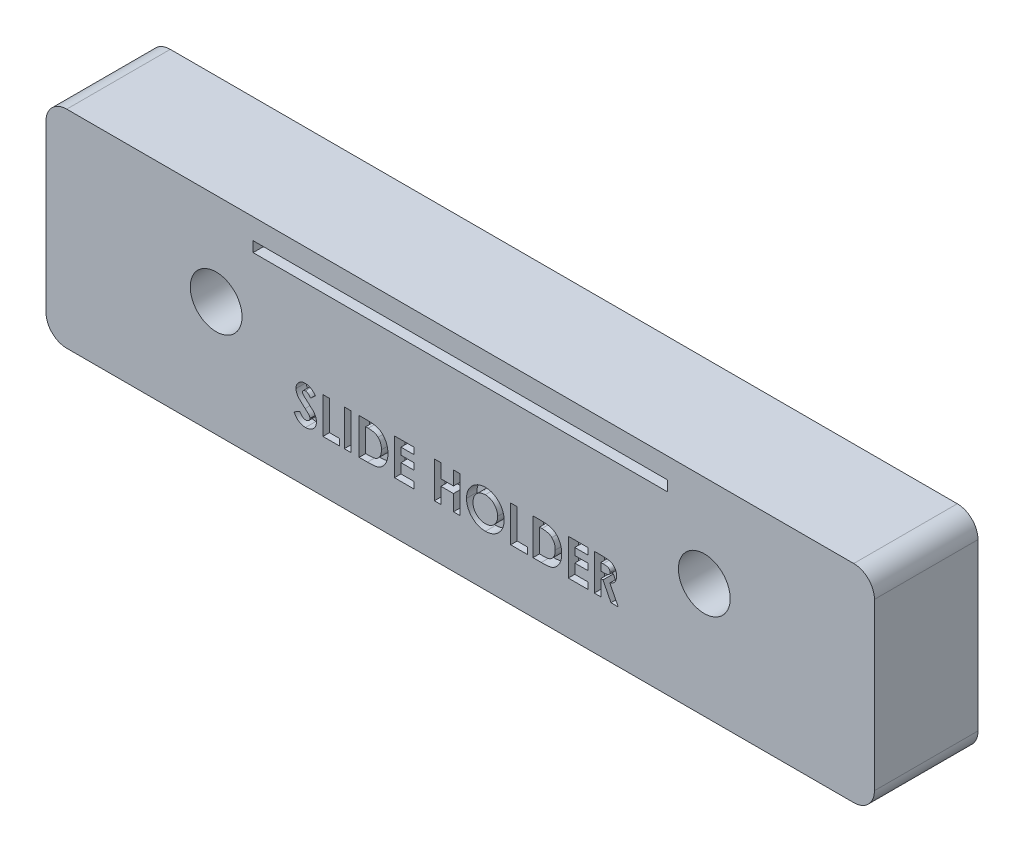
from build123d import *

# Parameters (mm, degrees)
SKETCH1_W           = 80
SKETCH1_H           = 20
BOSS_EXTRUDE1_DEPTH = 10
SKETCH2_R           = 2.5
CUT_EXTRUDE1_DEPTH  = 10
SKETCH3_W           = 40
SKETCH3_H           = 1
CUT_EXTRUDE2_DEPTH  = 47.813641243
SKETCH4_W           = 0.628205128
SKETCH4_H           = 3.5
CUT_EXTRUDE3_DEPTH  = 1
FILLET1_R           = 2


with BuildPart() as part:
    # Sketch1 → Boss-Extrude1 (new body)
    with BuildSketch(Plane.XY):
        with Locations((-0.372188153, 11.484958231)):
            Rectangle(SKETCH1_W, SKETCH1_H)
    extrude(amount=BOSS_EXTRUDE1_DEPTH)

    # Sketch2 → Cut-Extrude1 (cut)
    with BuildSketch(Plane.XY.offset(10)):
        with Locations((-23.942188153, 12.584958231)):
            Circle(SKETCH2_R)
        with Locations((23.197811847, 12.584958231)):
            Circle(SKETCH2_R)
    extrude(amount=-CUT_EXTRUDE1_DEPTH, mode=Mode.SUBTRACT)

    # Sketch3 → Cut-Extrude2 (cut, through all)
    with BuildSketch(Plane.XY.offset(10)):
        with Locations((-0.372188153, 18.984958231)):
            Rectangle(SKETCH3_W, SKETCH3_H)
    extrude(amount=-CUT_EXTRUDE2_DEPTH, mode=Mode.SUBTRACT)

    # Sketch4 → Cut-Extrude3 (cut)
    # profile 1 of 11: a face of its own
    with BuildSketch(Plane.XY.offset(10)):
        with BuildLine():
            Line((-14.349752255, 9.517309993), (-14.819503858, 9.087522333))
            add(Edge.make_bspline(
                [(-14.819503858, 9.087522333), (-14.839626002, 9.11590671), (-14.878257713, 9.170400754), (-14.940875688, 9.243369565), (-15.00321091, 9.30561739), (-15.065840877, 9.356884188), (-15.129320719, 9.396858475), (-15.193540243, 9.425160711), (-15.25813537, 9.443152712), (-15.301533325, 9.445393148), (-15.322909306, 9.446496692)],
                knots=[0, 0, 0, 0, 1.299362458, 2.494594718, 3.587462134, 4.587049575, 5.512617175, 6.380583204, 7.202344345, 8, 8, 8, 8], degree=3))
            add(Edge.make_bspline(
                [(-15.322909306, 9.446496692), (-15.342848209, 9.445797436), (-15.381344991, 9.444447357), (-15.43622501, 9.431027668), (-15.484948273, 9.407867256), (-15.527467227, 9.377583068), (-15.561148512, 9.341097643), (-15.588040406, 9.302833813), (-15.603182803, 9.260599199), (-15.60517584, 9.231590762), (-15.606162511, 9.217229865)],
                knots=[0, 0, 0, 0, 1.185010067, 2.2879431, 3.333075148, 4.379039566, 5.372662701, 6.27520591, 7.14612461, 8, 8, 8, 8], degree=3))
            add(Edge.make_bspline(
                [(-15.606162511, 9.217229865), (-15.605544214, 9.202661878), (-15.60429905, 9.173323975), (-15.592272456, 9.130325625), (-15.574144945, 9.088311232), (-15.556823368, 9.062735072), (-15.547969403, 9.049661756)],
                knots=[0, 0, 0, 0, 0.967525499, 1.948461899, 2.951351359, 4, 4, 4, 4], degree=3))
            add(Edge.make_bspline(
                [(-15.547969403, 9.049661756), (-15.53992019, 9.039500005), (-15.521391965, 9.016108994), (-15.486062436, 8.97906128), (-15.441695968, 8.933674587), (-15.386585244, 8.881509632), (-15.323018063, 8.820690357), (-15.248048005, 8.753607592), (-15.163833033, 8.678183861), (-15.103974983, 8.625661507), (-15.072608826, 8.59813932)],
                knots=[0, 0, 0, 0, 0.473873513, 1.090794244, 1.870441696, 2.795289791, 3.865433203, 5.087734844, 6.473946851, 8, 8, 8, 8], degree=3))
            add(Edge.make_bspline(
                [(-15.072608826, 8.59813932), (-15.043167175, 8.572659057), (-14.987293039, 8.524302811), (-14.907795239, 8.455668883), (-14.837929914, 8.393920612), (-14.776679284, 8.339984707), (-14.724971849, 8.293295256), (-14.682590231, 8.253629086), (-14.649016812, 8.221758422), (-14.629932288, 8.202508522), (-14.621787511, 8.194293166)],
                knots=[0, 0, 0, 0, 1.543621617, 2.929473131, 4.163658386, 5.240097082, 6.164993805, 6.925417477, 7.541396219, 8, 8, 8, 8], degree=3))
            add(Edge.make_bspline(
                [(-14.621787511, 8.194293166), (-14.590887927, 8.160853198), (-14.531488074, 8.096569836), (-14.454289205, 7.996950841), (-14.390752039, 7.899702389), (-14.341598483, 7.802994593), (-14.30447574, 7.705432152), (-14.278303714, 7.604622352), (-14.262629114, 7.499511794), (-14.260888867, 7.42778667), (-14.260008665, 7.391508711)],
                knots=[0, 0, 0, 0, 1.206664779, 2.319633467, 3.337109185, 4.282041471, 5.190008762, 6.099243693, 7.03861361, 8, 8, 8, 8], degree=3))
            add(Edge.make_bspline(
                [(-14.260008665, 7.391508711), (-14.260635171, 7.35616029), (-14.261864397, 7.286805371), (-14.276920065, 7.185314779), (-14.298388563, 7.088183877), (-14.331582628, 6.996469588), (-14.372039357, 6.908666449), (-14.422757711, 6.826142153), (-14.482319463, 6.748061522), (-14.550586376, 6.675820342), (-14.626097688, 6.610266479), (-14.707090746, 6.551908881), (-14.794357542, 6.50372725), (-14.887152482, 6.464053114), (-14.985425894, 6.433495565), (-15.089060706, 6.410910687), (-15.198215434, 6.3973556), (-15.27285701, 6.395938576), (-15.310990236, 6.395214641)],
                knots=[0, 0, 0, 0, 1.043214005, 2.046824704, 3.02475056, 3.976699089, 4.921714032, 5.875962561, 6.831408892, 7.817874052, 8.806269674, 9.781291748, 10.760897367, 11.74438705, 12.757449933, 13.795994037, 14.874007457, 16, 16, 16, 16], degree=3))
            add(Edge.make_bspline(
                [(-15.310990236, 6.395214641), (-15.340924494, 6.395745695), (-15.400211491, 6.396797485), (-15.487591563, 6.405384482), (-15.5719669, 6.419242981), (-15.65324246, 6.43910635), (-15.731784406, 6.464275933), (-15.807595962, 6.495019614), (-15.880153776, 6.531813909), (-15.950006855, 6.57390218), (-16.016815626, 6.622772208), (-16.081424861, 6.677424859), (-16.143192799, 6.738700717), (-16.202416099, 6.806454866), (-16.258715834, 6.88087917), (-16.313934896, 6.960937133), (-16.365619184, 7.048114521), (-16.397546867, 7.109270164), (-16.413854819, 7.140507109)],
                knots=[0, 0, 0, 0, 1.016823716, 2.013894106, 2.979844003, 3.91962641, 4.853723003, 5.779685073, 6.695824784, 7.614987388, 8.547259901, 9.504950863, 10.487499108, 11.500346958, 12.559593716, 13.656357062, 14.802919212, 16, 16, 16, 16], degree=3))
            Line((-16.413854819, 7.140507109), (-15.861370845, 7.472137718))
            add(Edge.make_bspline(
                [(-15.861370845, 7.472137718), (-15.840972034, 7.436679704), (-15.801865771, 7.368703661), (-15.735596552, 7.277369232), (-15.66770712, 7.199156412), (-15.596627932, 7.135447618), (-15.523223285, 7.085390981), (-15.447138618, 7.049617036), (-15.368320474, 7.027473004), (-15.314633135, 7.024768707), (-15.287853217, 7.023419769)],
                knots=[0, 0, 0, 0, 1.283663364, 2.460892379, 3.537111102, 4.529833553, 5.449777664, 6.316464042, 7.160231139, 8, 8, 8, 8], degree=3))
            add(Edge.make_bspline(
                [(-15.287853217, 7.023419769), (-15.260614206, 7.024521385), (-15.207766557, 7.026658679), (-15.132333302, 7.046400227), (-15.063173237, 7.077395904), (-15.003391788, 7.121622461), (-14.952772626, 7.17266663), (-14.915412779, 7.229455602), (-14.891943071, 7.290899899), (-14.889461754, 7.333583149), (-14.888213794, 7.355050378)],
                knots=[0, 0, 0, 0, 1.13588714, 2.203786484, 3.234766741, 4.283437687, 5.291419208, 6.222934724, 7.106237994, 8, 8, 8, 8], degree=3))
            add(Edge.make_bspline(
                [(-14.888213794, 7.355050378), (-14.889366234, 7.375022141), (-14.891707306, 7.415592866), (-14.908950922, 7.475915011), (-14.935907953, 7.536209722), (-14.967800022, 7.585665076), (-15.000254195, 7.627072702), (-15.031287705, 7.662950538), (-15.06907831, 7.702589265), (-15.113530191, 7.746038746), (-15.164056023, 7.793681479), (-15.220698365, 7.845512797), (-15.284105834, 7.901076128), (-15.328922359, 7.938925321), (-15.352356422, 7.958716243)],
                knots=[0, 0, 0, 0, 0.916159276, 1.861089862, 2.860218735, 3.940849679, 4.552606315, 5.27541173, 6.11797699, 7.06649574, 8.129236253, 9.306560635, 10.591630461, 12, 12, 12, 12], degree=3))
            add(Edge.make_bspline(
                [(-15.352356422, 7.958716243), (-15.396905508, 7.996409042), (-15.482408689, 8.068752932), (-15.603235531, 8.175602581), (-15.712111335, 8.275463367), (-15.808095732, 8.36956979), (-15.892411711, 8.456183922), (-15.964488248, 8.536009275), (-16.023533551, 8.609661594), (-16.085665999, 8.696897837), (-16.144704248, 8.803201193), (-16.195730049, 8.931096453), (-16.228833434, 9.058975486), (-16.232542208, 9.144826424), (-16.23436764, 9.187081628)],
                knots=[0, 0, 0, 0, 1.345494975, 2.582412109, 3.71882943, 4.751509156, 5.681369928, 6.505683931, 7.230279997, 7.856715994, 8.973648664, 10.023341002, 11.027102913, 12, 12, 12, 12], degree=3))
            add(Edge.make_bspline(
                [(-16.23436764, 9.187081628), (-16.233608445, 9.21704675), (-16.232112751, 9.27608126), (-16.218770923, 9.362882906), (-16.198831054, 9.4466392), (-16.169872639, 9.527044562), (-16.132288114, 9.603998281), (-16.086643167, 9.677877078), (-16.03222902, 9.748000989), (-15.97090795, 9.814323527), (-15.903347831, 9.87493478), (-15.831151258, 9.928430283), (-15.75472687, 9.973613363), (-15.674542192, 10.011096009), (-15.590100355, 10.039786593), (-15.502023437, 10.060123909), (-15.410185107, 10.072219896), (-15.347718657, 10.073864205), (-15.315898088, 10.07470182)],
                knots=[0, 0, 0, 0, 1.010766082, 1.991317756, 2.957454644, 3.913069143, 4.869106762, 5.843196583, 6.838735724, 7.860187025, 8.887984031, 9.89767229, 10.887916223, 11.879572884, 12.879850636, 13.892031539, 14.926195476, 16, 16, 16, 16], degree=3))
            add(Edge.make_bspline(
                [(-15.315898088, 10.07470182), (-15.274660206, 10.073193251), (-15.192509958, 10.07018802), (-15.071048447, 10.046688095), (-14.952409922, 10.009731987), (-14.856808774, 9.965148509), (-14.780740726, 9.921960473), (-14.722441673, 9.882198369), (-14.663119248, 9.836648743), (-14.602295053, 9.785168054), (-14.541099296, 9.72678634), (-14.477791889, 9.662893423), (-14.413235472, 9.592937118), (-14.371284036, 9.542960658), (-14.349752255, 9.517309993)],
                knots=[0, 0, 0, 0, 1.282922637, 2.555718331, 3.837320111, 5.142675274, 5.830281639, 6.55870424, 7.337177975, 8.157850921, 9.037902056, 9.96903443, 10.957596896, 12, 12, 12, 12], degree=3))
        make_face()
    # profile 2 of 11: a face of its own
    with BuildSketch(Plane.XY.offset(10)):
        Polygon((-13.631803537, 9.984958231), (-13.003598409, 9.984958231), (-13.003598409, 7.113163359), (-12.016418922, 7.113163359), (-12.016418922, 6.484958231), (-13.631803537, 6.484958231), align=None)
    # profile 3 of 11: a face of its own
    with BuildSketch(Plane.XY.offset(10)):
        with Locations((-11.253598409, 8.234958231)):
            Rectangle(SKETCH4_W, SKETCH4_H)
    # profile 4 of 11: a face of its own
    with BuildSketch(Plane.XY.offset(10)):
        with BuildLine():
            Line((-10.131803537, 9.984958231), (-9.340237031, 9.984958231))
            add(Edge.make_bspline(
                [(-9.340237031, 9.984958231), (-9.278525317, 9.984526845), (-9.159235876, 9.983692971), (-8.986409077, 9.974297216), (-8.825702145, 9.959847212), (-8.677011488, 9.939968613), (-8.540641944, 9.913663783), (-8.41676936, 9.880669529), (-8.304977988, 9.842583152), (-8.204042061, 9.797766801), (-8.111897268, 9.745515387), (-8.024402846, 9.687311506), (-7.941730589, 9.621022981), (-7.862720321, 9.547928649), (-7.788391688, 9.466691271), (-7.717506852, 9.378656434), (-7.651801394, 9.282547511), (-7.589289181, 9.18066889), (-7.532755202, 9.07258882), (-7.483444154, 8.959227255), (-7.44213599, 8.841313719), (-7.408570967, 8.718722549), (-7.38181577, 8.591860707), (-7.363095698, 8.460472201), (-7.351522763, 8.324678672), (-7.350348786, 8.232644731), (-7.349752255, 8.185879705)],
                knots=[0, 0, 0, 0, 1.44355588, 2.790409838, 4.047694926, 5.217575253, 6.298404546, 7.294384826, 8.214239204, 9.058592145, 9.873746385, 10.689560431, 11.514393297, 12.350027578, 13.205127629, 14.088021785, 14.991911688, 15.926770944, 16.882954281, 17.842803888, 18.816321264, 19.80318086, 20.814351908, 21.847355356, 22.906180909, 24, 24, 24, 24], degree=3))
            add(Edge.make_bspline(
                [(-7.349752255, 8.185879705), (-7.351314295, 8.119891209), (-7.354389262, 7.989988993), (-7.380291065, 7.799358988), (-7.422183052, 7.616621114), (-7.48108699, 7.44320482), (-7.554112105, 7.280654401), (-7.641348783, 7.131836367), (-7.741517929, 6.997549498), (-7.853452569, 6.878462432), (-7.974650522, 6.776105485), (-8.100599634, 6.68844425), (-8.232526881, 6.619316051), (-8.348773223, 6.575478436), (-8.449573303, 6.548215232), (-8.538074683, 6.532102416), (-8.638603221, 6.517325992), (-8.752096258, 6.505907089), (-8.878055925, 6.495724234), (-9.016984298, 6.490191267), (-9.168431567, 6.485594192), (-9.273626014, 6.485175772), (-9.32831796, 6.484958231)],
                knots=[0, 0, 0, 0, 1.315458931, 2.589557908, 3.828601765, 5.048913369, 6.235739168, 7.376350998, 8.481830359, 9.569842114, 10.627874879, 11.640079404, 12.624025415, 13.590060155, 14.111227486, 14.704434459, 15.382649715, 16.137166398, 16.978595427, 17.902333227, 18.909396075, 20, 20, 20, 20], degree=3))
            Line((-9.32831796, 6.484958231), (-10.131803537, 6.484958231))
            Line((-10.131803537, 6.484958231), (-10.131803537, 9.984958231))
        make_face()
        with BuildLine():
            Line((-9.503598409, 9.356753102), (-9.503598409, 7.113163359))
            Line((-9.503598409, 7.113163359), (-9.175473409, 7.113163359))
            add(Edge.make_bspline(
                [(-9.175473409, 7.113163359), (-9.136431573, 7.1132349), (-9.061341126, 7.113372496), (-8.952927517, 7.11992635), (-8.852672419, 7.126504612), (-8.760851809, 7.138990373), (-8.676797445, 7.152898632), (-8.601664016, 7.172253879), (-8.533902693, 7.192584927), (-8.474341169, 7.21846887), (-8.419787665, 7.247602971), (-8.369277353, 7.281736947), (-8.320520759, 7.319641441), (-8.274429429, 7.362431277), (-8.230828917, 7.409539837), (-8.189977191, 7.461209851), (-8.15132899, 7.517283672), (-8.115876339, 7.578057777), (-8.083479517, 7.642890377), (-8.054739905, 7.711153473), (-8.030910527, 7.783415551), (-8.011105006, 7.85900015), (-7.996951715, 7.93856532), (-7.985242567, 8.021521734), (-7.97920616, 8.108198056), (-7.978377701, 8.167175523), (-7.977957383, 8.197097654)],
                knots=[0, 0, 0, 0, 1.50275155, 2.890291501, 4.180787663, 5.369391935, 6.45668281, 7.458360028, 8.354766181, 9.177074746, 9.954075863, 10.732690366, 11.5210699, 12.329727389, 13.151100085, 13.990027547, 14.863562427, 15.770965086, 16.696477834, 17.652329173, 18.619756807, 19.62365428, 20.657822005, 21.729286259, 22.847956731, 24, 24, 24, 24], degree=3))
            add(Edge.make_bspline(
                [(-7.977957383, 8.197097654), (-7.978794513, 8.24295049), (-7.980426852, 8.332359969), (-7.996168771, 8.462586827), (-8.021793612, 8.585214922), (-8.058357792, 8.699789149), (-8.104448074, 8.806631522), (-8.162140805, 8.90483686), (-8.228953114, 8.996054876), (-8.281786464, 9.049566291), (-8.308185749, 9.076304384)],
                knots=[0, 0, 0, 0, 1.13821349, 2.219428113, 3.251817212, 4.244760574, 5.201143372, 6.134805572, 7.068016741, 8, 8, 8, 8], degree=3))
            add(Edge.make_bspline(
                [(-8.308185749, 9.076304384), (-8.334217943, 9.099088855), (-8.387385752, 9.145623556), (-8.480730952, 9.201384028), (-8.583592529, 9.250375068), (-8.698323646, 9.289219499), (-8.823815478, 9.319939331), (-8.960815458, 9.341126048), (-9.10858992, 9.354740408), (-9.210964624, 9.356067831), (-9.263814755, 9.356753102)],
                knots=[0, 0, 0, 0, 0.813307809, 1.661089106, 2.549956539, 3.493439533, 4.508053171, 5.589449661, 6.755572447, 8, 8, 8, 8], degree=3))
            Line((-9.263814755, 9.356753102), (-9.503598409, 9.356753102))
        make_face(mode=Mode.SUBTRACT)
    # profile 5 of 11: a face of its own
    with BuildSketch(Plane.XY.offset(10)):
        Polygon((-6.721547127, 9.984958231), (-4.836931742, 9.984958231), (-4.836931742, 9.356753102), (-6.093341999, 9.356753102), (-6.093341999, 8.683676179), (-4.836931742, 8.683676179), (-4.836931742, 8.055471051), (-6.093341999, 8.055471051), (-6.093341999, 7.113163359), (-4.836931742, 7.113163359), (-4.836931742, 6.484958231), (-6.721547127, 6.484958231), align=None)
    # profile 6 of 11: a face of its own
    with BuildSketch(Plane.XY.offset(10)):
        Polygon((-2.862572768, 9.984958231), (-2.23436764, 9.984958231), (-2.23436764, 8.638804384), (-1.022829178, 8.638804384), (-1.022829178, 9.984958231), (-0.39462405, 9.984958231), (-0.39462405, 6.484958231), (-1.022829178, 6.484958231), (-1.022829178, 8.010599256), (-2.23436764, 8.010599256), (-2.23436764, 6.484958231), (-2.862572768, 6.484958231), align=None)
    # profile 7 of 11: a face of its own
    with BuildSketch(Plane.XY.offset(10)):
        with BuildLine():
            add(Edge.make_bspline(
                [(2.057899989, 10.07470182), (2.118751778, 10.073126259), (2.238886993, 10.070015743), (2.415562542, 10.044087165), (2.585822101, 10.001840266), (2.749588678, 9.94311402), (2.906452222, 9.866317822), (3.056966042, 9.773628896), (3.200591005, 9.663297792), (3.335855357, 9.537898354), (3.460864014, 9.40153194), (3.569184088, 9.254709252), (3.661555474, 9.101234612), (3.738113125, 8.940696782), (3.796426027, 8.771983959), (3.837346602, 8.595956357), (3.863636044, 8.412664053), (3.866659734, 8.287866977), (3.868196463, 8.224441404)],
                knots=[0, 0, 0, 0, 1.014329547, 2.002516266, 2.970391464, 3.935626869, 4.897733899, 5.877609409, 6.878433252, 7.912639331, 8.949961323, 9.958554974, 10.949718813, 11.932905612, 12.9188844, 13.919928257, 14.942845884, 16, 16, 16, 16], degree=3))
            add(Edge.make_bspline(
                [(3.868196463, 8.224441404), (3.866559913, 8.16173049), (3.863335039, 8.038156623), (3.838419852, 7.85655343), (3.796810169, 7.68241145), (3.7394863, 7.515336509), (3.664317115, 7.35613786), (3.573747072, 7.203799042), (3.4653862, 7.059733797), (3.343186846, 6.924019434), (3.208655961, 6.800829529), (3.066166398, 6.692268638), (2.916376085, 6.600278235), (2.759504267, 6.524900457), (2.595214541, 6.46640254), (2.423912721, 6.425128009), (2.245609409, 6.400044643), (2.124354509, 6.396840833), (2.062807841, 6.395214641)],
                knots=[0, 0, 0, 0, 1.051557043, 2.072126891, 3.067553643, 4.050577992, 5.02905126, 6.015227836, 7.017913613, 8.04756643, 9.074058332, 10.072836633, 11.047628519, 12.017157415, 12.98668631, 13.966869689, 14.968021931, 16, 16, 16, 16], degree=3))
            add(Edge.make_bspline(
                [(2.062807841, 6.395214641), (1.998437406, 6.396673416), (1.871958299, 6.399539709), (1.68685556, 6.426796848), (1.509511142, 6.467855622), (1.34141484, 6.529133638), (1.180854737, 6.605736312), (1.029010515, 6.700077097), (0.885933204, 6.812000088), (0.752443519, 6.938638896), (0.63150154, 7.077209529), (0.524746521, 7.223597113), (0.434696295, 7.376683378), (0.361347566, 7.53653997), (0.303522374, 7.70217342), (0.262733272, 7.874592483), (0.238638176, 8.053383636), (0.235281869, 8.174822161), (0.233581078, 8.236360474)],
                knots=[0, 0, 0, 0, 1.067978421, 2.098431617, 3.099715153, 4.085208694, 5.062210972, 6.048429807, 7.046490867, 8.072918869, 9.098532598, 10.095778865, 11.076610158, 12.041847152, 13.011192615, 13.984257998, 14.978533688, 16, 16, 16, 16], degree=3))
            add(Edge.make_bspline(
                [(0.233581078, 8.236360474), (0.234114884, 8.27776023), (0.235175737, 8.360035525), (0.247954826, 8.481963312), (0.26635304, 8.601511233), (0.293563126, 8.718202648), (0.326616426, 8.832860761), (0.369441644, 8.944418305), (0.418188333, 9.054067022), (0.475144249, 9.160511823), (0.53847372, 9.262773328), (0.607571811, 9.36036915), (0.682612269, 9.452119214), (0.763353364, 9.538626463), (0.850073339, 9.619322279), (0.941631484, 9.695349023), (1.039803493, 9.764687155), (1.142440689, 9.829030051), (1.248964427, 9.887214215), (1.358941058, 9.936738836), (1.470104848, 9.979987843), (1.583940794, 10.014121873), (1.699228942, 10.041923682), (1.817200912, 10.060309496), (1.936790894, 10.073088231), (2.017434485, 10.074162681), (2.057899989, 10.07470182)],
                knots=[0, 0, 0, 0, 1.034744296, 2.056386356, 3.06226378, 4.057406941, 5.050368692, 6.043467995, 7.042652155, 8.049140477, 9.059438543, 10.048523776, 11.036952808, 12.020949711, 13.004946614, 13.997082645, 14.994316842, 16.007702937, 17.024872941, 18.026463647, 19.021641123, 20.005082605, 20.995858141, 21.984425357, 22.988620895, 24, 24, 24, 24], degree=3))
        make_face()
        with BuildLine():
            add(Edge.make_bspline(
                [(2.048084283, 9.446496692), (2.007131037, 9.445397825), (1.926305717, 9.4432291), (1.807749692, 9.42670635), (1.693931721, 9.40031764), (1.585482743, 9.362093917), (1.481932729, 9.313444819), (1.383098118, 9.254540331), (1.290347565, 9.183355678), (1.20244433, 9.103712446), (1.123038223, 9.014971583), (1.052880422, 8.919870656), (0.994169643, 8.818568482), (0.944998997, 8.712006135), (0.907984399, 8.598985349), (0.881620011, 8.480391428), (0.864958701, 8.356020029), (0.862858522, 8.271236208), (0.861786206, 8.227947013)],
                knots=[0, 0, 0, 0, 1.033739768, 2.040188636, 3.016340934, 3.979330865, 4.937572243, 5.900995986, 6.878200029, 7.884839167, 8.891893314, 9.879764717, 10.863503415, 11.843163062, 12.837761627, 13.859916423, 14.907309254, 16, 16, 16, 16], degree=3))
            add(Edge.make_bspline(
                [(0.861786206, 8.227947013), (0.863207934, 8.179972846), (0.865994284, 8.085951429), (0.885599381, 7.948795519), (0.919141751, 7.819265375), (0.967576281, 7.697994508), (1.027647806, 7.583636298), (1.102247105, 7.477592367), (1.190166024, 7.379227773), (1.257898046, 7.321798425), (1.292274989, 7.292650538)],
                knots=[0, 0, 0, 0, 1.078454662, 2.113592447, 3.107694534, 4.079536787, 5.043276885, 6.005368276, 6.987637804, 8, 8, 8, 8], degree=3))
            add(Edge.make_bspline(
                [(1.292274989, 7.292650538), (1.320436267, 7.271117199), (1.376124346, 7.22853567), (1.465014644, 7.173958705), (1.556554147, 7.127180801), (1.651433636, 7.089384809), (1.749452731, 7.059655117), (1.85059799, 7.038835902), (1.954726098, 7.025770044), (2.025142405, 7.024208427), (2.060704476, 7.023419769)],
                knots=[0, 0, 0, 0, 1.023928204, 2.024787132, 3.009472467, 3.9914905, 4.972207045, 5.96565515, 6.972602802, 8, 8, 8, 8], degree=3))
            add(Edge.make_bspline(
                [(2.060704476, 7.023419769), (2.10095353, 7.024527954), (2.18014481, 7.026708342), (2.29649385, 7.043027688), (2.407959765, 7.070645913), (2.515234544, 7.108534324), (2.618008854, 7.157794254), (2.715780409, 7.218525774), (2.80872063, 7.28998318), (2.896511877, 7.370672302), (2.976757226, 7.459762743), (3.046768622, 7.555370928), (3.107346111, 7.655390324), (3.155494252, 7.761236552), (3.193971213, 7.871910475), (3.220018293, 7.987902243), (3.236820353, 8.108733694), (3.238921123, 8.190963766), (3.239991335, 8.232854865)],
                knots=[0, 0, 0, 0, 1.026359118, 2.019393844, 2.989460624, 3.950973911, 4.916101784, 5.890408035, 6.881132271, 7.902007068, 8.92769091, 9.933912415, 10.920395702, 11.90457117, 12.894218921, 13.903490204, 14.931958862, 16, 16, 16, 16], degree=3))
            add(Edge.make_bspline(
                [(3.239991335, 8.232854865), (3.238884094, 8.274505079), (3.236704658, 8.356487173), (3.220356589, 8.477007967), (3.192913512, 8.592487665), (3.154911326, 8.703114858), (3.106384547, 8.808998001), (3.046376261, 8.909764747), (2.975097031, 9.005317679), (2.894187343, 9.095005641), (2.806122121, 9.177423132), (2.711575305, 9.248946533), (2.613192423, 9.311098094), (2.50871609, 9.359785117), (2.400283804, 9.398573965), (2.287233907, 9.427138629), (2.169138215, 9.443113027), (2.088795273, 9.44535875), (2.048084283, 9.446496692)],
                knots=[0, 0, 0, 0, 1.055025985, 2.07665775, 3.074803781, 4.057872707, 5.035505728, 6.020516407, 7.023567878, 8.050795229, 9.077271434, 10.074415901, 11.050397877, 12.019801805, 12.988065821, 13.964604439, 14.968634123, 16, 16, 16, 16], degree=3))
        make_face(mode=Mode.SUBTRACT)
    # profile 8 of 11: a face of its own
    with BuildSketch(Plane.XY.offset(10)):
        Polygon((4.496401591, 9.984958231), (5.124606719, 9.984958231), (5.124606719, 7.113163359), (6.111786206, 7.113163359), (6.111786206, 6.484958231), (4.496401591, 6.484958231), align=None)
    # profile 9 of 11: a face of its own
    with BuildSketch(Plane.XY.offset(10)):
        with BuildLine():
            Line((6.650247745, 9.984958231), (7.441814251, 9.984958231))
            add(Edge.make_bspline(
                [(7.441814251, 9.984958231), (7.503525965, 9.984526845), (7.622815406, 9.983692971), (7.795642205, 9.974297216), (7.956349137, 9.959847212), (8.105039794, 9.939968613), (8.241409338, 9.913663783), (8.365281923, 9.880669529), (8.477073294, 9.842583152), (8.578009221, 9.797766801), (8.670154014, 9.745515387), (8.757648436, 9.687311506), (8.840320693, 9.621022981), (8.919330961, 9.547928649), (8.993659594, 9.466691271), (9.06454443, 9.378656434), (9.130249888, 9.282547511), (9.192762101, 9.18066889), (9.24929608, 9.07258882), (9.298607128, 8.959227255), (9.339915292, 8.841313719), (9.373480315, 8.718722549), (9.400235512, 8.591860707), (9.418955584, 8.460472201), (9.430528519, 8.324678672), (9.431702496, 8.232644731), (9.432299027, 8.185879705)],
                knots=[0, 0, 0, 0, 1.44355588, 2.790409838, 4.047694926, 5.217575253, 6.298404546, 7.294384826, 8.214239204, 9.058592145, 9.873746385, 10.689560431, 11.514393297, 12.350027578, 13.205127629, 14.088021785, 14.991911688, 15.926770944, 16.882954281, 17.842803888, 18.816321264, 19.80318086, 20.814351908, 21.847355356, 22.906180909, 24, 24, 24, 24], degree=3))
            add(Edge.make_bspline(
                [(9.432299027, 8.185879705), (9.430736987, 8.119891209), (9.42766202, 7.989988993), (9.401760217, 7.799358988), (9.35986823, 7.616621114), (9.300964292, 7.44320482), (9.227939177, 7.280654401), (9.140702499, 7.131836367), (9.040533353, 6.997549498), (8.928598713, 6.878462432), (8.80740076, 6.776105485), (8.681451648, 6.68844425), (8.549524401, 6.619316051), (8.43327806, 6.575478436), (8.332477979, 6.548215232), (8.243976599, 6.532102416), (8.143448061, 6.517325992), (8.029955024, 6.505907089), (7.903995357, 6.495724234), (7.765066984, 6.490191267), (7.613619715, 6.485594192), (7.508425268, 6.485175772), (7.453733322, 6.484958231)],
                knots=[0, 0, 0, 0, 1.315458931, 2.589557908, 3.828601765, 5.048913369, 6.235739168, 7.376350998, 8.481830359, 9.569842114, 10.627874879, 11.640079404, 12.624025415, 13.590060155, 14.111227486, 14.704434459, 15.382649715, 16.137166398, 16.978595427, 17.902333227, 18.909396075, 20, 20, 20, 20], degree=3))
            Line((7.453733322, 6.484958231), (6.650247745, 6.484958231))
            Line((6.650247745, 6.484958231), (6.650247745, 9.984958231))
        make_face()
        with BuildLine():
            Line((7.278452873, 9.356753102), (7.278452873, 7.113163359))
            Line((7.278452873, 7.113163359), (7.606577873, 7.113163359))
            add(Edge.make_bspline(
                [(7.606577873, 7.113163359), (7.645619709, 7.1132349), (7.720710156, 7.113372496), (7.829123765, 7.11992635), (7.929378863, 7.126504612), (8.021199473, 7.138990373), (8.105253837, 7.152898632), (8.180387267, 7.172253879), (8.248148589, 7.192584927), (8.307710113, 7.21846887), (8.362263617, 7.247602971), (8.412773929, 7.281736947), (8.461530523, 7.319641441), (8.507621853, 7.362431277), (8.551222365, 7.409539837), (8.592074091, 7.461209851), (8.630722292, 7.517283672), (8.666174943, 7.578057777), (8.698571765, 7.642890377), (8.727311377, 7.711153473), (8.751140756, 7.783415551), (8.770946276, 7.85900015), (8.785099567, 7.93856532), (8.796808715, 8.021521734), (8.802845122, 8.108198056), (8.803673581, 8.167175523), (8.804093899, 8.197097654)],
                knots=[0, 0, 0, 0, 1.50275155, 2.890291501, 4.180787663, 5.369391935, 6.45668281, 7.458360028, 8.354766181, 9.177074746, 9.954075863, 10.732690366, 11.5210699, 12.329727389, 13.151100085, 13.990027547, 14.863562427, 15.770965086, 16.696477834, 17.652329173, 18.619756807, 19.62365428, 20.657822005, 21.729286259, 22.847956731, 24, 24, 24, 24], degree=3))
            add(Edge.make_bspline(
                [(8.804093899, 8.197097654), (8.803256769, 8.24295049), (8.80162443, 8.332359969), (8.785882511, 8.462586827), (8.76025767, 8.585214922), (8.72369349, 8.699789149), (8.677603208, 8.806631522), (8.619910477, 8.90483686), (8.553098168, 8.996054876), (8.500264818, 9.049566291), (8.473865533, 9.076304384)],
                knots=[0, 0, 0, 0, 1.13821349, 2.219428113, 3.251817212, 4.244760574, 5.201143372, 6.134805572, 7.068016741, 8, 8, 8, 8], degree=3))
            add(Edge.make_bspline(
                [(8.473865533, 9.076304384), (8.447833339, 9.099088855), (8.39466553, 9.145623556), (8.30132033, 9.201384028), (8.198458753, 9.250375068), (8.083727636, 9.289219499), (7.958235804, 9.319939331), (7.821235824, 9.341126048), (7.673461363, 9.354740408), (7.571086658, 9.356067831), (7.518236527, 9.356753102)],
                knots=[0, 0, 0, 0, 0.813307809, 1.661089106, 2.549956539, 3.493439533, 4.508053171, 5.589449661, 6.755572447, 8, 8, 8, 8], degree=3))
            Line((7.518236527, 9.356753102), (7.278452873, 9.356753102))
        make_face(mode=Mode.SUBTRACT)
    # profile 10 of 11: a face of its own
    with BuildSketch(Plane.XY.offset(10)):
        Polygon((10.060504155, 9.984958231), (11.94511954, 9.984958231), (11.94511954, 9.356753102), (10.688709283, 9.356753102), (10.688709283, 8.683676179), (11.94511954, 8.683676179), (11.94511954, 8.055471051), (10.688709283, 8.055471051), (10.688709283, 7.113163359), (11.94511954, 7.113163359), (11.94511954, 6.484958231), (10.060504155, 6.484958231), align=None)
    # profile 11 of 11: a face of its own
    with BuildSketch(Plane.XY.offset(10)):
        with BuildLine():
            Line((12.573324668, 9.984958231), (13.305295822, 9.984958231))
            add(Edge.make_bspline(
                [(13.305295822, 9.984958231), (13.353678892, 9.984786498), (13.446733166, 9.984456209), (13.580912345, 9.979245119), (13.704174374, 9.97199346), (13.816701753, 9.960927236), (13.918446342, 9.946254761), (14.009510111, 9.92895834), (14.089890399, 9.90924536), (14.160265103, 9.884681432), (14.223774794, 9.856973694), (14.282974655, 9.825136994), (14.339170723, 9.789525846), (14.39198739, 9.749203222), (14.441883643, 9.704894517), (14.488953615, 9.65655513), (14.532532163, 9.603775162), (14.572349449, 9.546888118), (14.608639699, 9.487044251), (14.640712669, 9.424161396), (14.666794462, 9.358195823), (14.689840521, 9.290100876), (14.706439851, 9.218903125), (14.717984443, 9.145295692), (14.726436941, 9.069019471), (14.726922919, 9.017200793), (14.727170822, 8.990767525)],
                knots=[0, 0, 0, 0, 1.749336639, 3.364467119, 4.854658419, 6.213483162, 7.451590619, 8.570285859, 9.5643256, 10.440900261, 11.26203566, 12.067320669, 12.869050712, 13.665104639, 14.467235401, 15.27997916, 16.102287765, 16.939272006, 17.78853747, 18.631303466, 19.488103222, 20.351255419, 21.228522269, 22.127379805, 23.044756219, 24, 24, 24, 24], degree=3))
            add(Edge.make_bspline(
                [(14.727170822, 8.990767525), (14.72652686, 8.963177267), (14.725264167, 8.909077798), (14.718462619, 8.829610091), (14.706031525, 8.753580948), (14.687202824, 8.681212972), (14.665561678, 8.611605459), (14.636784506, 8.546042713), (14.604306622, 8.483571217), (14.565733589, 8.425074654), (14.52340157, 8.3692537), (14.474170322, 8.318247061), (14.421229273, 8.269313325), (14.361602416, 8.225517534), (14.297918157, 8.183898375), (14.228911156, 8.146180334), (14.155031778, 8.111415265), (14.103090916, 8.092027861), (14.076529796, 8.082113679)],
                knots=[0, 0, 0, 0, 1.099860209, 2.156625411, 3.176576793, 4.16617041, 5.135385252, 6.078461593, 7.016046972, 7.938469504, 8.868247731, 9.803980173, 10.76021508, 11.73834243, 12.748633912, 13.790971185, 14.870363756, 16, 16, 16, 16], degree=3))
            Line((14.076529796, 8.082113679), (14.884222104, 6.484958231))
            Line((14.884222104, 6.484958231), (14.185904796, 6.484958231))
            Line((14.185904796, 6.484958231), (13.414670822, 8.010599256))
            Line((13.414670822, 8.010599256), (13.201529796, 8.010599256))
            Line((13.201529796, 8.010599256), (13.201529796, 6.484958231))
            Line((13.201529796, 6.484958231), (12.573324668, 6.484958231))
            Line((12.573324668, 6.484958231), (12.573324668, 9.984958231))
        make_face()
        with BuildLine():
            Line((13.201529796, 8.638804384), (13.446221303, 8.638804384))
            add(Edge.make_bspline(
                [(13.446221303, 8.638804384), (13.476136873, 8.639141314), (13.533418763, 8.639786461), (13.615797644, 8.642778921), (13.690617314, 8.64998927), (13.758199075, 8.659099277), (13.81888299, 8.669618096), (13.872127783, 8.684692203), (13.918753872, 8.700844489), (13.958208738, 8.720917591), (13.991918069, 8.743745062), (14.021023919, 8.769677636), (14.04509863, 8.799691288), (14.064913345, 8.832970378), (14.080327039, 8.869809249), (14.091577855, 8.909803495), (14.097865397, 8.953408702), (14.0985888, 8.983502233), (14.098965694, 8.999180987)],
                knots=[0, 0, 0, 0, 1.688639943, 3.233382647, 4.650958383, 5.928841754, 7.082724185, 8.122798841, 9.049171256, 9.863274652, 10.613301712, 11.341792392, 12.054588806, 12.776240173, 13.521029143, 14.301969904, 15.115324896, 16, 16, 16, 16], degree=3))
            add(Edge.make_bspline(
                [(14.098965694, 8.999180987), (14.098253142, 9.017730098), (14.096853465, 9.05416639), (14.082964328, 9.106621873), (14.060855821, 9.155173012), (14.030551114, 9.19960044), (13.992386275, 9.238548591), (13.948589111, 9.272881696), (13.898214374, 9.300029746), (13.851571158, 9.317936311), (13.809136734, 9.328649994), (13.770841005, 9.336633735), (13.726494321, 9.342292042), (13.676063201, 9.348293684), (13.619676197, 9.352185444), (13.557025966, 9.355025654), (13.488292438, 9.356187723), (13.440378641, 9.356559216), (13.415371944, 9.356753102)],
                knots=[0, 0, 0, 0, 1.020303359, 2.004196876, 2.966617323, 3.9489082, 4.950758222, 5.960522915, 7.003732012, 8.091992268, 8.70421221, 9.413913587, 10.24622431, 11.166358409, 12.212345909, 13.359657661, 14.621978493, 16, 16, 16, 16], degree=3))
            Line((13.415371944, 9.356753102), (13.201529796, 9.356753102))
            Line((13.201529796, 9.356753102), (13.201529796, 8.638804384))
        make_face(mode=Mode.SUBTRACT)
    extrude(amount=-CUT_EXTRUDE3_DEPTH, mode=Mode.SUBTRACT)

    # Fillet1
    fillet1_edges = [part.edges().sort_by_distance(p)[0] for p in [
        (39.627811847, 21.484958231, 5),
        (39.627811847, 1.484958231, 5),
        (-40.372188153, 1.484958231, 5),
        (-40.372188153, 21.484958231, 5),
    ]]
    fillet(fillet1_edges, radius=FILLET1_R)


solid = part.part
